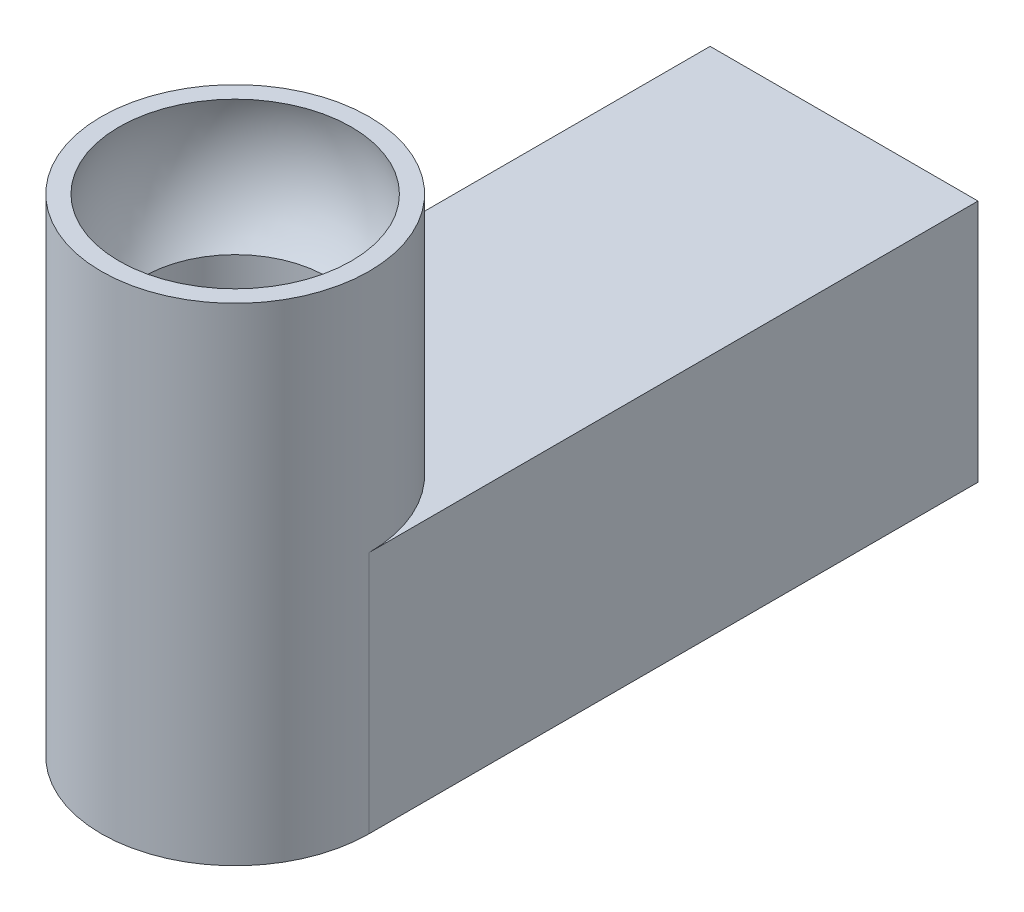
from build123d import *

# Parameters (mm, degrees)
EXTRUDE_1_DEPTH = 20
SKETCH_6_R      = 7.5


with BuildPart() as part:
    # Sweep 1: sweep along a path in 草图2
    with BuildLine(Plane(origin=(0, 0, 0), x_dir=(1, 0, 0), z_dir=(0, 1, 0))) as sweep_1_path:
        CenterArc((0, 0), 11, 0, 360)
    # 草图1 → Sweep 1 (sweep)
    with BuildSketch(Plane.XY):
        with BuildLine():
            Line((11, 3), (11, -17))
            Line((11, -17), (0, -17))
            Line((0, -17), (0, -10))
            ThreePointArc((0, -10), (8.062257748, -5.916079783), (9.539392014, 3))
            Line((9.539392014, 3), (11, 3))
        make_face()
    sweep(path=sweep_1_path.line)

    # 草图4 → 凸台-拉伸1 (add)
    with BuildSketch(Plane.XZ.offset(17)):
        with BuildLine():
            Line((-11, 0), (-11, -50))
            Line((-11, -50), (11, -50))
            Line((11, -50), (11, 0))
            ThreePointArc((11, 0), (0, 11), (-11, 0))
        make_face()
    extrude(amount=EXTRUDE_1_DEPTH)

    # Sweep 1 2: sweep along a path in 草图5
    with BuildLine(Plane(origin=(0, 0, 0), x_dir=(0, 0, -1), z_dir=(1, 0, 0))) as sweep_1_2_path:
        Line((50, -27), (0, -27))
        Line((0, -27), (0, 3))
    # 草图6 → Sweep 1 2 (sweep, cut)
    with BuildSketch(Plane(origin=(0, 0, -50), x_dir=(-1, 0, 0), z_dir=(0, 0, -1))):
        with Locations((0, -27)):
            Circle(SKETCH_6_R)
    sweep(path=sweep_1_2_path.line, transition=Transition.RIGHT, mode=Mode.SUBTRACT)


solid = part.part
